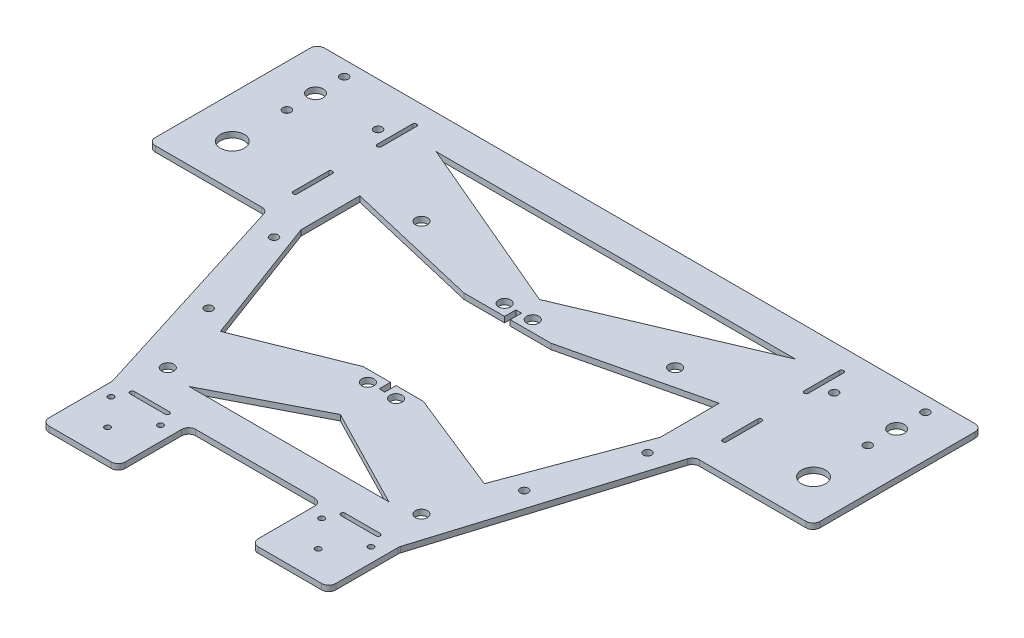
from build123d import *

# Parameters (mm, degrees)
SKETCH26_R          = 1
SKETCH26_R_2        = 2.15
SKETCH26_R_3        = 1.45
SKETCH26_R_4        = 4.25
SKETCH26_R_5        = 2.75
BOSS_EXTRUDE4_DEPTH = 2


with BuildPart() as part:
    # Sketch26 → Boss-Extrude4 (new body)
    with BuildSketch(Plane(origin=(0, 0, 0), x_dir=(1, 0, 0), z_dir=(0, 1, 0))):
        with BuildLine():
            Line((-20.823616498, -51.176455051), (21.352676296, -51.176455051))
            ThreePointArc((21.352676296, -51.176455051), (23.120443249, -51.908688098), (23.852676296, -53.676455051))
            Line((23.852676296, -53.676455051), (23.852676296, -73.676455051))
            ThreePointArc((23.852676296, -73.676455051), (24.584909343, -75.444222004), (26.352676296, -76.176455051))
            Line((26.352676296, -76.176455051), (48.872676296, -76.176455051))
            ThreePointArc((48.872676296, -76.176455051), (50.640443249, -75.444222004), (51.372676296, -73.676455051))
            Line((51.372676296, -73.676455051), (51.372676296, -51.552742091))
            ThreePointArc((51.372676296, -51.552742091), (51.400522432, -51.180646307), (51.483440514, -50.816839667))
            Line((51.483440514, -50.816839667), (75.469917209, 27.059447373))
            ThreePointArc((75.469917209, 27.059447373), (76.374187682, 28.334733163), (77.859152991, 28.823544949))
            Line((77.859152991, 28.823544949), (115.689249226, 28.823544949))
            ThreePointArc((115.689249226, 28.823544949), (117.457016179, 29.555777996), (118.189249226, 31.323544949))
            Line((118.189249226, 31.323544949), (118.189249226, 86.323544949))
            ThreePointArc((118.189249226, 86.323544949), (117.457016179, 88.091311902), (115.689249226, 88.823544949))
            Line((115.689249226, 88.823544949), (76.013272408, 88.823544949))
            Line((76.013272408, 88.823544949), (-75.48421261, 88.823544949))
            Line((-75.48421261, 88.823544949), (-76.032763958, 88.823544949))
            Line((-76.032763958, 88.823544949), (-115.160189428, 88.823544949))
            ThreePointArc((-115.160189428, 88.823544949), (-116.927956381, 88.091311902), (-117.660189428, 86.323544949))
            Line((-117.660189428, 86.323544949), (-117.660189428, 31.323544949))
            ThreePointArc((-117.660189428, 31.323544949), (-116.927956381, 29.555777996), (-115.160189428, 28.823544949))
            Line((-115.160189428, 28.823544949), (-77.320558078, 28.823544949))
            ThreePointArc((-77.320558078, 28.823544949), (-75.840570727, 28.338399148), (-74.934991096, 27.071254903))
            Line((-74.934991096, 27.071254903), (-50.523941264, -50.812146542))
            ThreePointArc((-50.523941264, -50.812146542), (-50.438282088, -51.18164852), (-50.409508246, -51.559856495))
            Line((-50.409508246, -51.559856495), (-50.409508246, -73.676455051))
            ThreePointArc((-50.409508246, -73.676455051), (-49.677275199, -75.444222004), (-47.909508246, -76.176455051))
            Line((-47.909508246, -76.176455051), (-25.823616498, -76.176455051))
            ThreePointArc((-25.823616498, -76.176455051), (-24.055849545, -75.444222004), (-23.323616498, -73.676455051))
            Line((-23.323616498, -73.676455051), (-23.323616498, -53.676455051))
            ThreePointArc((-23.323616498, -53.676455051), (-22.591383451, -51.908688098), (-20.823616498, -51.176455051))
        make_face()
        with Locations((-37.083616498, -66.176455051)):
            Circle(SKETCH26_R, mode=Mode.SUBTRACT)
        with Locations((-45.843616498, -56.176455051)):
            Circle(SKETCH26_R, mode=Mode.SUBTRACT)
        with Locations((-28.323616498, -56.176455051)):
            Circle(SKETCH26_R, mode=Mode.SUBTRACT)
        with BuildLine():
            Line((-43.378108588, -50.422722318), (-30.878108588, -50.422722318))
            ThreePointArc((-30.878108588, -50.422722318), (-30.128108588, -51.172722318), (-30.878108588, -51.922722318))
            Line((-30.878108588, -51.922722318), (-43.378108588, -51.922722318))
            ThreePointArc((-43.378108588, -51.922722318), (-44.128108588, -51.172722318), (-43.378108588, -50.422722318))
        make_face(mode=Mode.SUBTRACT)
        with Locations((-44.735470101, -37.176455051)):
            Circle(SKETCH26_R_2, mode=Mode.SUBTRACT)
        with Locations((-55.732763009, -11.697986619)):
            Circle(SKETCH26_R_3, mode=Mode.SUBTRACT)
        with Locations((-4.735470101, -6.176455051)):
            Circle(SKETCH26_R_2, mode=Mode.SUBTRACT)
        with Locations((28.852676296, -56.176455051)):
            Circle(SKETCH26_R, mode=Mode.SUBTRACT)
        with Locations((37.612676296, -66.176455051)):
            Circle(SKETCH26_R, mode=Mode.SUBTRACT)
        with Locations((46.372676296, -56.176455051)):
            Circle(SKETCH26_R, mode=Mode.SUBTRACT)
        with BuildLine():
            ThreePointArc((31.407168386, -51.922722318), (30.657168386, -51.172722318), (31.407168386, -50.422722318))
            Line((31.407168386, -50.422722318), (43.907168386, -50.422722318))
            ThreePointArc((43.907168386, -50.422722318), (44.657168386, -51.172722318), (43.907168386, -51.922722318))
            Line((43.907168386, -51.922722318), (31.407168386, -51.922722318))
        make_face(mode=Mode.SUBTRACT)
        with Locations((45.264529899, -37.176455051)):
            Circle(SKETCH26_R_2, mode=Mode.SUBTRACT)
        Polygon((35.712257561, -39.176455051), (-35.183197763, -39.176455051), (0.264529899, -20.951240159), align=None, mode=Mode.SUBTRACT)
        with Locations((5.264529899, -6.176455051)):
            Circle(SKETCH26_R_2, mode=Mode.SUBTRACT)
        with Locations((56.261822807, -11.697986619)):
            Circle(SKETCH26_R_3, mode=Mode.SUBTRACT)
        with Locations((-65.98606306, 21.76646972)):
            Circle(SKETCH26_R_3, mode=Mode.SUBTRACT)
        with Locations((-102.838209752, 43.823544949)):
            Circle(SKETCH26_R_4, mode=Mode.SUBTRACT)
        with BuildLine():
            ThreePointArc((-75.160005035, 39.191107079), (-75.910005035, 38.441107079), (-76.660005035, 39.191107079))
            Line((-76.660005035, 39.191107079), (-76.660005035, 51.691107079))
            ThreePointArc((-76.660005035, 51.691107079), (-75.910005035, 52.441107079), (-75.160005035, 51.691107079))
            Line((-75.160005035, 51.691107079), (-75.160005035, 39.191107079))
        make_face(mode=Mode.SUBTRACT)
        with Locations((-4.735470101, 42.323544949)):
            Circle(SKETCH26_R_2, mode=Mode.SUBTRACT)
        with Locations((-102.78421261, 63.123687889)):
            Circle(SKETCH26_R_3, mode=Mode.SUBTRACT)
        with Locations((-102.838212164, 73.323544949)):
            Circle(SKETCH26_R_5, mode=Mode.SUBTRACT)
        with Locations((-102.838214468, 83.523544949)):
            Circle(SKETCH26_R_3, mode=Mode.SUBTRACT)
        with Locations((-80.638212164, 73.323544949)):
            Circle(SKETCH26_R_3, mode=Mode.SUBTRACT)
        with BuildLine():
            ThreePointArc((-76.23421261, 81.095149015), (-75.48421261, 81.845149015), (-74.73421261, 81.095149015))
            Line((-74.73421261, 81.095149015), (-74.73421261, 68.595149015))
            ThreePointArc((-74.73421261, 68.595149015), (-75.48421261, 67.845149015), (-76.23421261, 68.595149015))
            Line((-76.23421261, 68.595149015), (-76.23421261, 81.095149015))
        make_face(mode=Mode.SUBTRACT)
        with Locations((-44.735470101, 52.823544949)):
            Circle(SKETCH26_R_2, mode=Mode.SUBTRACT)
        Polygon((-10.402901984, -2.176455051), (-46.543802783, -16.676455051), (-63.48421261, 28.823544949), (-63.48421261, 49.70968094), (-15.178445609, 38.323544949), (-0.735470101, 38.323544949), (-0.735470101, 42.323544949), (1.264529899, 42.323544949), (1.264529899, 38.323544949), (15.707505407, 38.323544949), (64.013272408, 49.70968094), (64.013272408, 28.823544949), (47.072862581, -16.676455051), (10.931961782, -2.176455051), (1.264529899, -2.176455051), (1.264529899, -6.176455051), (-0.735470101, -6.176455051), (-0.735470101, -2.176455051), align=None, mode=Mode.SUBTRACT)
        with Locations((5.264529899, 42.323544949)):
            Circle(SKETCH26_R_2, mode=Mode.SUBTRACT)
        with Locations((66.515122858, 21.76646972)):
            Circle(SKETCH26_R_3, mode=Mode.SUBTRACT)
        with BuildLine():
            Line((77.189064833, 51.691107079), (77.189064833, 39.191107079))
            ThreePointArc((77.189064833, 39.191107079), (76.439064833, 38.441107079), (75.689064833, 39.191107079))
            Line((75.689064833, 39.191107079), (75.689064833, 51.691107079))
            ThreePointArc((75.689064833, 51.691107079), (76.439064833, 52.441107079), (77.189064833, 51.691107079))
        make_face(mode=Mode.SUBTRACT)
        with Locations((103.367269549, 43.823544949)):
            Circle(SKETCH26_R_4, mode=Mode.SUBTRACT)
        Polygon((0.264529899, 49.70968094), (-63.538214468, 76.823544949), (64.067274266, 76.823544949), align=None, mode=Mode.SUBTRACT)
        with Locations((45.264529899, 52.823544949)):
            Circle(SKETCH26_R_2, mode=Mode.SUBTRACT)
        with Locations((103.313272408, 63.123687889)):
            Circle(SKETCH26_R_3, mode=Mode.SUBTRACT)
        with Locations((81.167271962, 73.323544949)):
            Circle(SKETCH26_R_3, mode=Mode.SUBTRACT)
        with BuildLine():
            Line((75.263272408, 68.595149015), (75.263272408, 81.095149015))
            ThreePointArc((75.263272408, 81.095149015), (76.013272408, 81.845149015), (76.763272408, 81.095149015))
            Line((76.763272408, 81.095149015), (76.763272408, 68.595149015))
            ThreePointArc((76.763272408, 68.595149015), (76.013272408, 67.845149015), (75.263272408, 68.595149015))
        make_face(mode=Mode.SUBTRACT)
        with Locations((103.367271962, 73.323544949)):
            Circle(SKETCH26_R_5, mode=Mode.SUBTRACT)
        with Locations((103.367274266, 83.523544949)):
            Circle(SKETCH26_R_3, mode=Mode.SUBTRACT)
    extrude(amount=BOSS_EXTRUDE4_DEPTH)


solid = part.part
